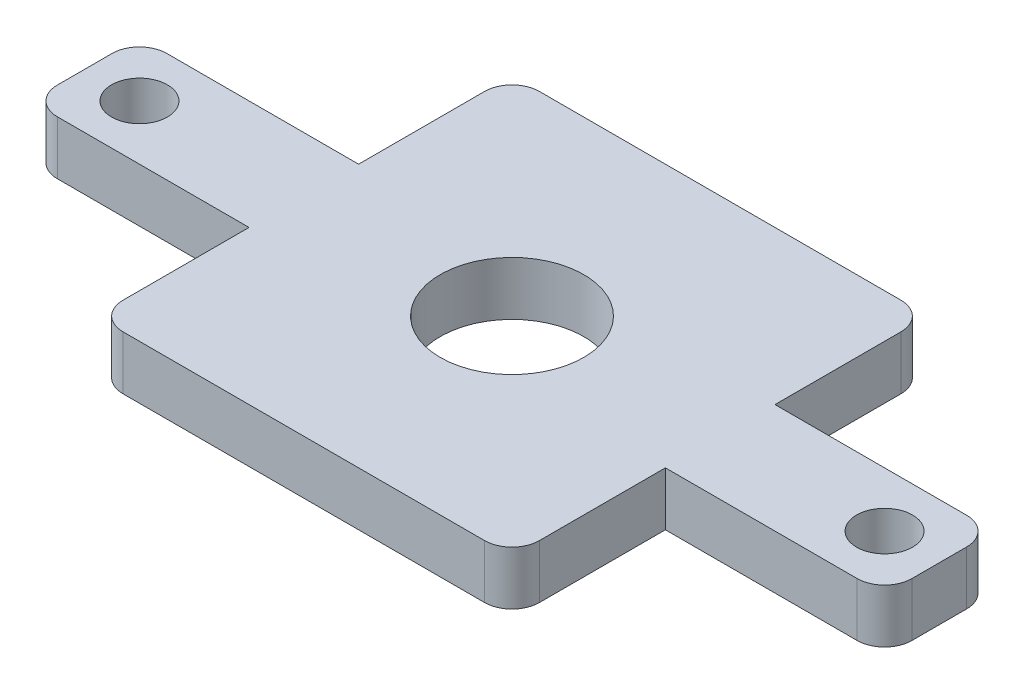
from build123d import *

# Parameters (mm, degrees)
SKETCH1_R           = 6.55
SKETCH1_R_2         = 2.55
BOSS_EXTRUDE1_DEPTH = 4.9
FILLET1_R           = 2.5


with BuildPart() as part:
    # Sketch1 → Boss-Extrude1 (new body)
    with BuildSketch(Plane(origin=(0, 0, 0), x_dir=(1, 0, 0), z_dir=(0, 1, 0))):
        Polygon((-19, -5), (-19, -19), (19, -19), (19, -5), (39, -5), (39, 5), (19, 5), (19, 19), (-19, 19), (-19, 5), (-39, 5), (-39, -5), align=None)
        Circle(SKETCH1_R, mode=Mode.SUBTRACT)
        with Locations((-34, 0)):
            Circle(SKETCH1_R_2, mode=Mode.SUBTRACT)
        with Locations((34, 0)):
            Circle(SKETCH1_R_2, mode=Mode.SUBTRACT)
    extrude(amount=BOSS_EXTRUDE1_DEPTH)

    # Fillet1
    fillet1_edges = [part.edges().sort_by_distance(p)[0] for p in [
        (39, 2.45, -5),
        (39, 2.45, 5),
        (-39, 2.45, -5),
        (-39, 2.45, 5),
        (19, 2.45, 19),
        (-19, 2.45, 19),
        (-19, 2.45, -19),
        (19, 2.45, -19),
    ]]
    fillet(fillet1_edges, radius=FILLET1_R)


solid = part.part
